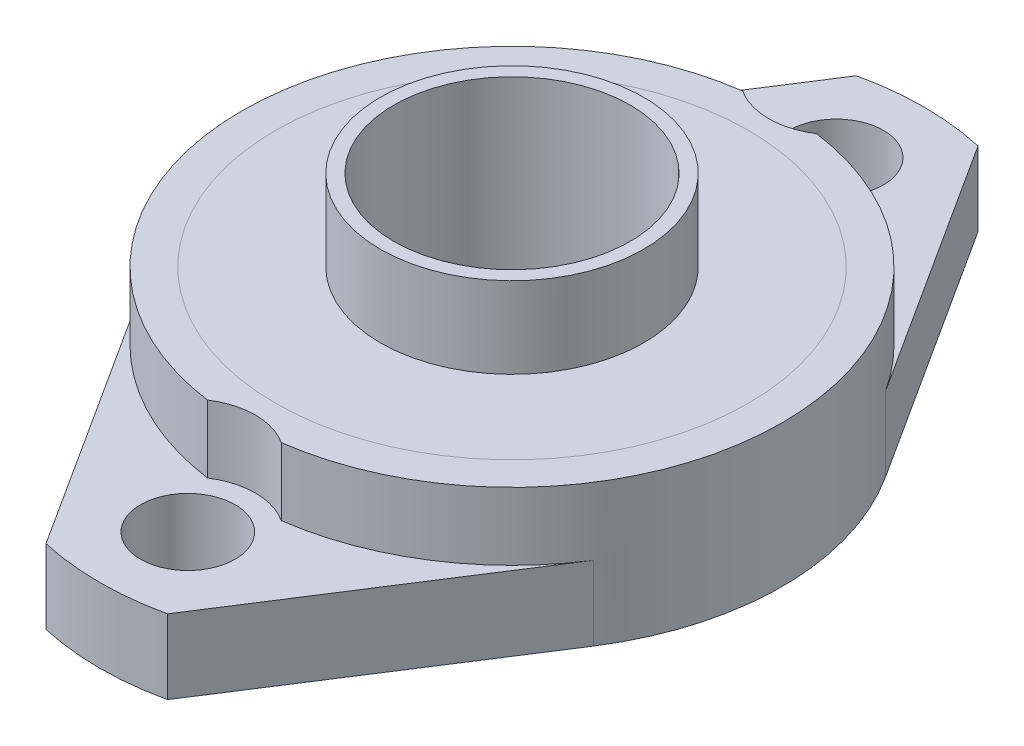
from build123d import *
from build123d.topology import SkipClean

# Parameters (mm, degrees)
SKETCH1_R                = 7
SKETCH1_R_2              = 35
BOSS_EXTRUDE1_DEPTH      = 11
SKETCH2_R                = 40
SKETCH2_R_2              = 35
BOSS_EXTRUDE2_DEPTH      = 10
CUT_EXTRUDE1_START       = -10
CUT_EXTRUDE1_DEPTH       = 10
SKETCH4_R                = 35
SKETCH4_R_2              = 19.5
BOSS_EXTRUDE3_DEPTH      = 21
BOSS_EXTRUDE4_DEPTH      = 12
BOSS_EXTRUDE4_DEPTH_BACK = 21
SKETCH5_R                = 19.5
SKETCH5_R_2              = 17.5
SKETCH6_R                = 35
CUT_EXTRUDE2_DEPTH       = 3


# Read off the part's stored shape, not the designer's step: Cut-Extrude1
with BuildPart() as part:
    # Sketch1 → Boss-Extrude1 (new body)
    # profile 1 of 3: a face of its own
    with BuildSketch(Plane(origin=(0, 0, 0), x_dir=(1, 0, 0), z_dir=(0, 1, 0))):
        with BuildLine():
            Line((-9, 60), (-33.654753977, 21.61845357))
            ThreePointArc((-33.654753977, 21.61845357), (-21.532195831, 33.710006566), (-5.464373249, 39.625))
            ThreePointArc((-5.464373249, 39.625), (0, 38), (5.464373249, 39.625))
            ThreePointArc((5.464373249, 39.625), (21.532195831, 33.710006566), (33.654753977, 21.61845357))
            Line((33.654753977, 21.61845357), (9, 60))
            ThreePointArc((9, 60), (0, 61), (-9, 60))
        make_face()
        with Locations(Location((0, 48, 0), (0, 0, 270))):
            Circle(SKETCH1_R, mode=Mode.SUBTRACT)
    # profile 2 of 3: a face of its own
    with BuildSketch(Plane(origin=(0, 0, 0), x_dir=(1, 0, 0), z_dir=(0, 1, 0))):
        with BuildLine():
            ThreePointArc((-5.464373249, -39.625), (0, -38), (5.464373249, -39.625))
            ThreePointArc((5.464373249, -39.625), (40, 0), (5.464373249, 39.625))
            ThreePointArc((5.464373249, 39.625), (0, 38), (-5.464373249, 39.625))
            ThreePointArc((-5.464373249, 39.625), (-40, 0), (-5.464373249, -39.625))
        make_face()
        with Locations(Location((0, 0, 0), (0, 0, 270))):
            Circle(SKETCH1_R_2, mode=Mode.SUBTRACT)
    # profile 3 of 3: a face of its own
    with BuildSketch(Plane(origin=(0, 0, 0), x_dir=(1, 0, 0), z_dir=(0, 1, 0))):
        with BuildLine():
            ThreePointArc((-5.464373249, -39.625), (-21.532195831, -33.710006566), (-33.654753977, -21.61845357))
            Line((-33.654753977, -21.61845357), (-9, -60))
            ThreePointArc((-9, -60), (0, -61), (9, -60))
            Line((9, -60), (33.654753977, -21.61845357))
            ThreePointArc((33.654753977, -21.61845357), (21.532195831, -33.710006566), (5.464373249, -39.625))
            ThreePointArc((5.464373249, -39.625), (0, -38), (-5.464373249, -39.625))
        make_face()
        with Locations(Location((0, -48, 0), (0, 0, 270))):
            Circle(SKETCH1_R, mode=Mode.SUBTRACT)
    extrude(amount=BOSS_EXTRUDE1_DEPTH)

    # Sketch2 → Boss-Extrude2 (add)
    with BuildSketch(Plane(origin=(0, 11, 0), x_dir=(1, 0, 0), z_dir=(0, 1, 0))):
        with Locations(Location((0, 0, 0), (0, 0, 32.715049731))):
            Circle(SKETCH2_R)
        with Locations(Location((0, 0, 0), (0, 0, 270))):
            Circle(SKETCH2_R_2, mode=Mode.SUBTRACT)
    extrude(amount=BOSS_EXTRUDE2_DEPTH)

    # Cut-Extrude1 outline → Cut-Extrude1 (cut)
    with SkipClean():  # the faces are left unmerged after this step: merging them gives an invalid solid
        with BuildSketch(Plane(origin=(0, 21, 0), x_dir=(1, 0, 0), z_dir=(0, 1, 0)).offset(CUT_EXTRUDE1_START)):
            with BuildLine():
                ThreePointArc((-5.464373249, -39.625), (0, -40), (5.464373249, -39.625))
                ThreePointArc((5.464373249, -39.625), (0, -38), (-5.464373249, -39.625))
            make_face()
            with BuildLine():
                ThreePointArc((5.464373249, 39.625), (0, 40), (-5.464373249, 39.625))
                ThreePointArc((-5.464373249, 39.625), (0, 38), (5.464373249, 39.625))
            make_face()
        extrude(amount=CUT_EXTRUDE1_DEPTH, mode=Mode.SUBTRACT)


with BuildPart() as body_2:
    # Sketch4 → Boss-Extrude3 (new body)
    with BuildSketch(Plane(origin=(0, 21, 0), x_dir=(1, 0, 0), z_dir=(0, 1, 0))):
        with Locations(Location((0, 0, 0), (0, 0, 270))):
            Circle(SKETCH4_R)
        with Locations(Location((0, 0, 0), (0, 0, 270))):
            Circle(SKETCH4_R_2, mode=Mode.SUBTRACT)
    extrude(amount=-BOSS_EXTRUDE3_DEPTH)


with BuildPart() as body_3:
    # Sketch5 → Boss-Extrude4 (new, two sides: drawn at the far end of the back side and taken through both)
    with BuildSketch(Plane(origin=(0, 21, 0), x_dir=(1, 0, 0), z_dir=(0, 1, 0)).offset(-BOSS_EXTRUDE4_DEPTH_BACK)):
        with Locations(Location((0, 0, 0), (0, 0, 270))):
            Circle(SKETCH5_R)
        with Locations(Location((0, 0, 0), (0, 0, 270))):
            Circle(SKETCH5_R_2, mode=Mode.SUBTRACT)
    extrude(amount=BOSS_EXTRUDE4_DEPTH + BOSS_EXTRUDE4_DEPTH_BACK)


with BuildPart() as cut_extrude2_tool:
    # Sketch6 → Cut-Extrude2 (new body)
    with BuildSketch(Plane(origin=(0, 0, 0), x_dir=(-1, 0, 0), z_dir=(0, -1, 0))):
        with Locations(Location((0, 0, 0), (0, 0, 270))):
            Circle(SKETCH6_R)
    extrude(amount=-CUT_EXTRUDE2_DEPTH)


with BuildPart() as body_2_1:
    add(body_2.part)

    # Cut-Extrude2: cut by cut_extrude2_tool
    add(cut_extrude2_tool.part, mode=Mode.SUBTRACT)


with BuildPart() as body_3_1:
    add(body_3.part)

    # Cut-Extrude2: cut by cut_extrude2_tool
    add(cut_extrude2_tool.part, mode=Mode.SUBTRACT)


solid = Compound([part.part, body_2_1.part, body_3_1.part])
